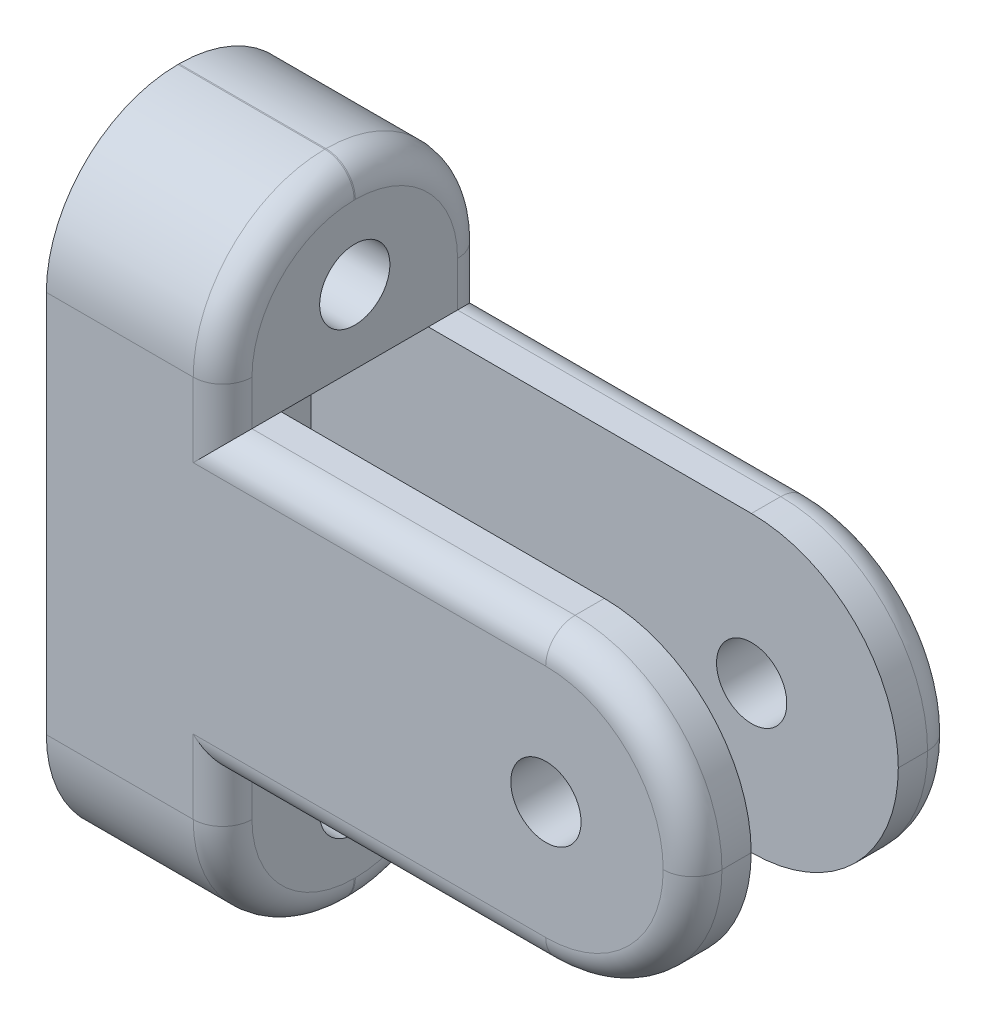
from build123d import *

# Parameters (mm, degrees)
SKETCH1_W             = 14.2875
SKETCH1_H             = 15.875
BOSS_EXTRUDE1_DEPTH   = 34.925
SKETCH2_W             = 7.9502
SKETCH2_H             = 15.875
CUT_EXTRUDE1_DEPTH    = 31.75
F_6_CLEARANCE_HOLE1_D = 3.7973
SKETCH5_W             = 14.2875
SKETCH5_H             = 9.525
BOSS_EXTRUDE2_DEPTH   = 9.525
F_6_CLEARANCE_HOLE2_D = 3.7973
FILLET1_R             = 7.112
FILLET3_R             = 7.9375
FILLET2_R             = 1.5875


with BuildPart() as part:
    # Sketch1 → Boss-Extrude1 (new body)
    with BuildSketch(Plane(origin=(0, 0, 0), x_dir=(0, 0, -1), z_dir=(1, 0, 0))):
        with Locations((7.14375, 7.9375)):
            Rectangle(SKETCH1_W, SKETCH1_H)
    extrude(amount=BOSS_EXTRUDE1_DEPTH)

    # Sketch2 → Cut-Extrude1 (cut)
    with BuildSketch(Plane(origin=(34.925, 0, 0), x_dir=(0, 0, -1), z_dir=(1, 0, 0))):
        with Locations((7.14375, 7.9375)):
            Rectangle(SKETCH2_W, SKETCH2_H)
    extrude(amount=-CUT_EXTRUDE1_DEPTH, mode=Mode.SUBTRACT)

    # #6 Clearance Hole1 (through all)
    with Locations(Plane(origin=(0, 0, -14.2875), x_dir=(-1, 0, 0), z_dir=(0, 0, -1))):
        with Locations((-27.0002, 7.9375)):
            Hole(F_6_CLEARANCE_HOLE1_D / 2)

    # Sketch5 → Boss-Extrude2 (add)
    with BuildSketch(Plane.ZY):
        with Locations((-7.14375, 20.6375)):
            Rectangle(SKETCH5_W, SKETCH5_H)
        with Locations((-7.14375, -4.7625)):
            Rectangle(SKETCH5_W, SKETCH5_H)
    extrude(amount=-BOSS_EXTRUDE2_DEPTH)

    # #6 Clearance Hole2 (through all)
    with Locations(Plane.ZY):
        with Locations((-7.14375, 19.84375), (-7.14375, -3.96875)):
            Hole(F_6_CLEARANCE_HOLE2_D / 2)

    # Fillet1
    fillet1_edges = [part.edges().sort_by_distance(p)[0] for p in [
        (4.7625, 25.4, -14.2875),
        (4.7625, 25.4, 0),
        (4.7625, -9.525, -14.2875),
        (4.7625, -9.525, 0),
    ]]
    fillet(fillet1_edges, radius=FILLET1_R)

    # Fillet3
    fillet3_edges = [part.edges().sort_by_distance(p)[0] for p in [
        (34.925, 0, -1.584325),
        (34.925, 0, -12.703175),
        (34.925, 15.875, -12.703175),
        (34.925, 15.875, -1.584325),
    ]]
    fillet(fillet3_edges, radius=FILLET3_R - 0.0001)  # a hair under: the kernel refuses the full size

    # Fillet2
    fillet2_edges = [part.edges().sort_by_distance(p)[0] for p in [
        (18.2563, 0, 0),
        (18.2563, 15.875, 0),
        (32.600189365, 13.550189365, 0),
        (32.600189365, 2.324810635, 0),
        (18.2563, 15.875, -14.2875),
        (18.2563, 0, -14.2875),
        (32.600189365, 13.550189365, -14.2875),
        (32.600189365, 2.324810635, -14.2875),
        (9.525, 17.0815, 0),
        (9.525, -1.2065, -14.2875),
        (9.525, 17.0815, -14.2875),
        (9.525, -9.525, -7.14375),
        (9.525, -1.2065, 0),
        (9.525, -7.441943428, -2.083056572),
        (9.525, -7.441943428, -12.204443428),
        (9.525, 25.4, -7.14375),
        (9.525, 23.316943428, -12.204443428),
        (9.525, 23.316943428, -2.083056572),
    ]]
    fillet(fillet2_edges, radius=FILLET2_R)


solid = part.part
